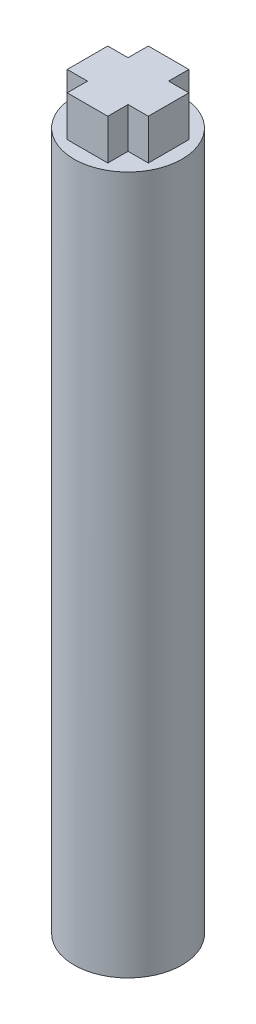
from build123d import *

# Parameters (mm, degrees)
SKETCH_1_R          = 4
EXTRUDE_1_DEPTH     = 4.65
SKETCH_2_R          = 4
EXTRUDE_2_DEPTH     = 45
SKETCH_3_R          = 2
CUT_EXTRUDE_1_DEPTH = 45
SKETCH_4_R          = 4
EXTRUDE_3_DEPTH     = 2
SKETCH_5_W          = 3
SKETCH_5_H          = 6
EXTRUDE_4_DEPTH     = 3
SKETCH_6_W          = 6
SKETCH_6_H          = 3
EXTRUDE_5_DEPTH     = 3
SKETCH_7_R          = 6.023355342
EXTRUDE_6_DEPTH     = 1
SKETCH_8_R          = 4
CUT_EXTRUDE_2_DEPTH = 0.5
CUT_EXTRUDE_START   = -1
SKETCH_10_R         = 6.023355342
CUT_EXTRUDE_7_DEPTH = 1


with BuildPart() as part:
    # 草图1 → 凸台-拉伸1 (new body)
    with BuildSketch(Plane(origin=(0, 0, 0), x_dir=(1, 0, 0), z_dir=(0, 1, 0))):
        Circle(SKETCH_1_R)
        Polygon((2.674449908, -1.624638736), (2.744203371, 1.503822194), (0.069753463, 3.12846093), (-2.674449908, 1.624638736), (-2.744203371, -1.503822194), (-0.069753463, -3.12846093), align=None, mode=Mode.SUBTRACT)
    extrude(amount=EXTRUDE_1_DEPTH)

    # 草图2 → 凸台-拉伸2 (add)
    with BuildSketch(Plane(origin=(0, 4.65, 0), x_dir=(1, 0, 0), z_dir=(0, 1, 0))):
        Circle(SKETCH_2_R)
    extrude(amount=EXTRUDE_2_DEPTH)

    # 草图3 → 切除-拉伸1 (cut)
    with BuildSketch(Plane.XZ.offset(-4.65)):
        Circle(SKETCH_3_R)
    extrude(amount=-CUT_EXTRUDE_1_DEPTH, mode=Mode.SUBTRACT)

    # 草图4 → 凸台-拉伸3 (add)
    with BuildSketch(Plane(origin=(0, 49.65, 0), x_dir=(1, 0, 0), z_dir=(0, 1, 0))):
        Circle(SKETCH_4_R)
    extrude(amount=EXTRUDE_3_DEPTH)

    # 草图5 → 凸台-拉伸4 (add)
    with BuildSketch(Plane(origin=(0, 51.65, 0), x_dir=(1, 0, 0), z_dir=(0, 1, 0))):
        Rectangle(SKETCH_5_W, SKETCH_5_H)
    extrude(amount=EXTRUDE_4_DEPTH)

    # 草图6 → 凸台-拉伸5 (add)
    with BuildSketch(Plane(origin=(0, 51.65, 0), x_dir=(1, 0, 0), z_dir=(0, 1, 0))):
        Rectangle(SKETCH_6_W, SKETCH_6_H)
    extrude(amount=EXTRUDE_5_DEPTH)

    # 草图7 → 凸台-拉伸6 (add)
    with BuildSketch(Plane.XZ):
        Circle(SKETCH_7_R)
    extrude(amount=EXTRUDE_6_DEPTH)

    # 草图8 → 切除-拉伸2 (cut)
    with BuildSketch(Plane.XZ.offset(1)):
        Circle(SKETCH_8_R)
    extrude(amount=-CUT_EXTRUDE_2_DEPTH, mode=Mode.SUBTRACT)

    # 草图10 → 切除-拉伸7 (cut)
    with BuildSketch(Plane.XZ.offset(1).offset(CUT_EXTRUDE_START)):
        Circle(SKETCH_10_R)
    extrude(amount=CUT_EXTRUDE_7_DEPTH, mode=Mode.SUBTRACT)


solid = part.part
